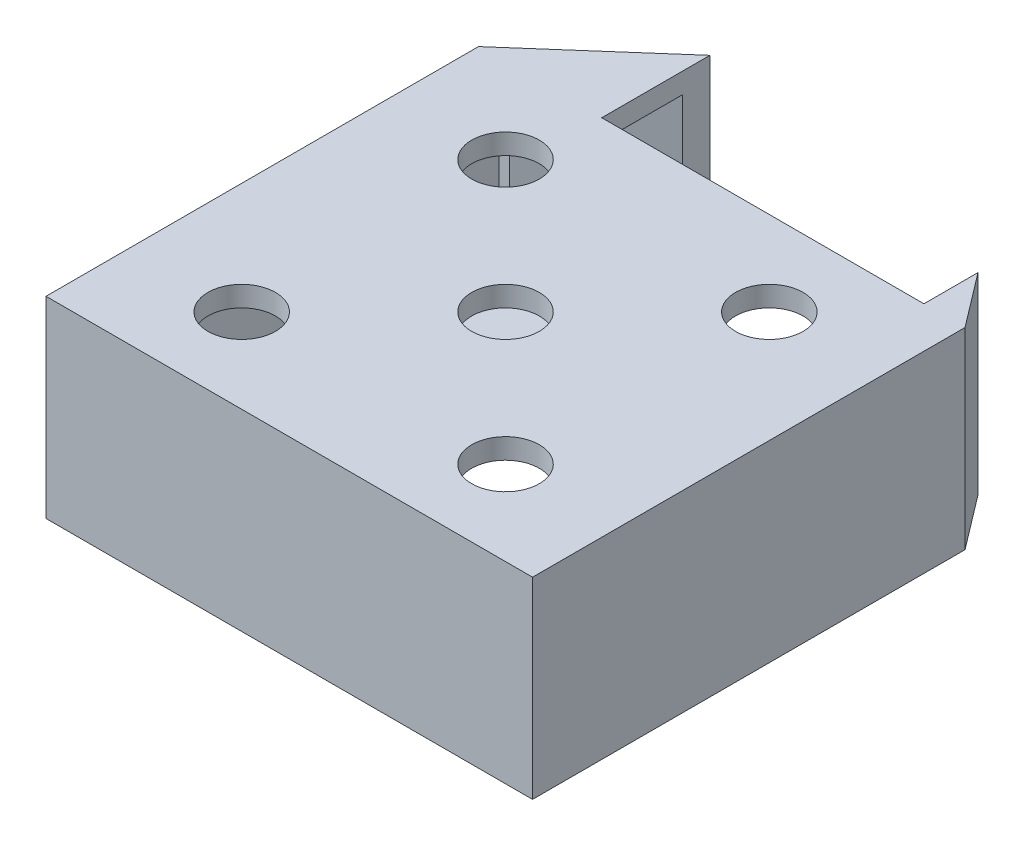
from build123d import *

# Parameters (mm, degrees)
SKETCH1_W           = 57.15
SKETCH1_H           = 50.8
BOSS_EXTRUDE1_DEPTH = 11.303
SKETCH2_W           = 52.350000456
SKETCH2_H           = 17.806000456
CUT_EXTRUDE1_DEPTH  = 48.514
SKETCH3_R           = 2.032
SKETCH3_R_2         = 11.1125
CUT_EXTRUDE2_DEPTH  = 2.399999772
SKETCH4_R           = 3.96875
CUT_EXTRUDE3_DEPTH  = 2.399999772
BOSS_EXTRUDE2_REACH = 46.415
SHELL1_START        = -35.538117353
SHELL1_OUTLINE_W    = 14.41756603
SHELL1_OUTLINE_H    = 17.806000456
SHELL1_DEPTH        = 8.538117353
SHELL2_START        = 34.277170944
SHELL2_OUTLINE_W    = 2.993867518
SHELL2_OUTLINE_H    = 17.806000456
SHELL2_DEPTH        = 1.442278976


with BuildPart() as part:
    # Sketch1 → Boss-Extrude1 (new, symmetric)
    with BuildSketch(Plane(origin=(0, 0, 0), x_dir=(1, 0, 0), z_dir=(0, 1, 0))):
        Rectangle(SKETCH1_W, SKETCH1_H)
    extrude(amount=BOSS_EXTRUDE1_DEPTH, both=True)

    # Sketch2 → Cut-Extrude1 (cut)
    with BuildSketch(Plane(origin=(0, 0, -25.4), x_dir=(-1, 0, 0), z_dir=(0, 0, -1))):
        Rectangle(SKETCH2_W, SKETCH2_H)
    extrude(amount=-CUT_EXTRUDE1_DEPTH, mode=Mode.SUBTRACT)

    # Sketch3 → Cut-Extrude2 (cut)
    with BuildSketch(Plane.XZ.offset(11.303)):
        with Locations(Location((-15.494, 15.494, 0), (0, 0, 270))):
            Circle(SKETCH3_R)
        with Locations(Location((15.494, 15.494, 0), (0, 0, 270))):
            Circle(SKETCH3_R)
        with Locations(Location((15.494, -15.494, 0), (0, 0, 270))):
            Circle(SKETCH3_R)
        with Locations(Location((-15.494, -15.494, 0), (0, 0, 270))):
            Circle(SKETCH3_R)
        with Locations(Location((0, 0, 0), (0, 0, 270))):
            Circle(SKETCH3_R_2)
    extrude(amount=-CUT_EXTRUDE2_DEPTH, mode=Mode.SUBTRACT)

    # Sketch4 → Cut-Extrude3 (cut)
    with BuildSketch(Plane(origin=(0, 11.303, 0), x_dir=(1, 0, 0), z_dir=(0, 1, 0))):
        with Locations(Location((-15.494, 15.494, 0), (0, 0, 270))):
            Circle(SKETCH4_R)
        with Locations(Location((15.494, 15.494, 0), (0, 0, 270))):
            Circle(SKETCH4_R)
        with Locations(Location((15.494, -15.494, 0), (0, 0, 270))):
            Circle(SKETCH4_R)
        with Locations(Location((-15.494, -15.494, 0), (0, 0, 270))):
            Circle(SKETCH4_R)
        with Locations(Location((0, 0, 0), (0, 0, 270))):
            Circle(SKETCH4_R)
    extrude(amount=-CUT_EXTRUDE3_DEPTH, mode=Mode.SUBTRACT)

    # Boss-Extrude2: up to this face of the body (flat: up to its plane)
    boss_extrude2_end = Plane(part.part.faces().sort_by_distance((0, -11.303, -24.635358744))[0])
    # Sketch5 → Boss-Extrude2 (add, up to the picked face)
    with BuildSketch(Plane(origin=(0, 11.303, 0), x_dir=(1, 0, 0), z_dir=(0, 1, 0)), mode=Mode.PRIVATE) as boss_extrude2_sk1:
        Polygon((-28.575, 25.4), (-14.097, 25.4), (-14.097, 38.1), align=None)
    boss_extrude2_tool1 = split(extrude(boss_extrude2_sk1.sketch, amount=-BOSS_EXTRUDE2_REACH, mode=Mode.PRIVATE), bisect_by=boss_extrude2_end, keep=Keep.BOTH, mode=Mode.PRIVATE)
    # Sketch5 → Boss-Extrude2 (add, up to the picked face)
    with BuildSketch(Plane(origin=(0, 11.303, 0), x_dir=(1, 0, 0), z_dir=(0, 1, 0)), mode=Mode.PRIVATE) as boss_extrude2_sk2:
        Polygon((28.575, 25.4), (23.749, 25.4), (23.749, 31.75), align=None)
    boss_extrude2_tool2 = split(extrude(boss_extrude2_sk2.sketch, amount=-BOSS_EXTRUDE2_REACH, mode=Mode.PRIVATE), bisect_by=boss_extrude2_end, keep=Keep.BOTH, mode=Mode.PRIVATE)
    add(boss_extrude2_tool1.solids().sort_by(Axis((-18.923, 11.303, -29.633333), (0, -1, 0)))[0])
    add(boss_extrude2_tool2.solids().sort_by(Axis((25.357667, 11.303, -27.516667), (0, -1, 0)))[0])

    # Shell1: read off the stored shape, not the designer's step
    # Shell1 outline → Shell1 (cut)
    with BuildSketch(Plane(origin=(0, 0, 0), x_dir=(0.7517591128712744, 0, -0.6594378183081364), z_dir=(0.6594378183081363, 0, 0.7517591128712744)).offset(SHELL1_START)):
        with Locations((5.21298669, 0)):
            Rectangle(SHELL1_OUTLINE_W, SHELL1_OUTLINE_H)
    extrude(amount=SHELL1_DEPTH, mode=Mode.SUBTRACT)

    # Shell2: read off the stored shape, not the designer's step
    # Shell2 outline → Shell2 (cut)
    with BuildSketch(Plane(origin=(0, 0, 0), x_dir=(0.6050832675335581, 0, 0.7961621941231024), z_dir=(0.7961621941231023, 0, -0.6050832675335583)).offset(SHELL2_START)):
        with Locations((-6.253198947, 0)):
            Rectangle(SHELL2_OUTLINE_W, SHELL2_OUTLINE_H)
    extrude(amount=SHELL2_DEPTH, mode=Mode.SUBTRACT)


solid = part.part
